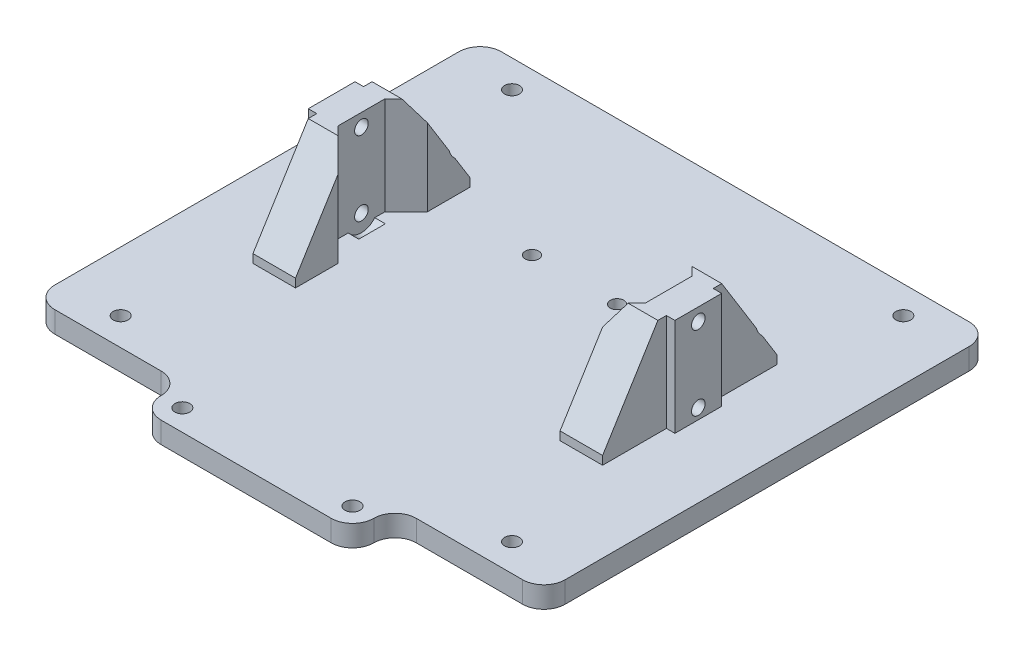
from build123d import *

# Parameters (mm, degrees)
EXTRUDE_1_DEPTH         = 5
FILLET_1_R              = 5
SKETCH_2_W              = 7
SKETCH_2_H              = 11
EXTRUDE_2_DEPTH         = 23
SKETCH_3_R              = 1.6
CUT_EXTRUDE_1_DEPTH     = 119.006186279
SKETCH_5_R              = 1.75
CUT_EXTRUDE_3_DEPTH     = 90.639556001
SKETCH_6_R              = 1.75
CUT_EXTRUDE_4_DEPTH     = 90.639556001
SKETCH2_R               = 4
CUT_EXTRUDE1_DEPTH      = 2.5
CUT_EXTRUDE2_START      = 2.5
SKETCH3_R               = 4
CUT_EXTRUDE2_DEPTH      = 2.5
CUT_EXTRUDE3_DEPTH      = 90.639556001
CUT_EXTRUDE3_DEPTH_BACK = 90.639556001
SKETCH4_R               = 1.6
EXTRUDE_4_DEPTH         = 5
EXTRUDE_4_DEPTH_BACK    = 5
EXTRUDE_5_DEPTH         = 5
EXTRUDE_5_DEPTH_BACK    = 5
CHAMFER_1_SIZE          = 5
SKETCH_12_R             = 1.6
EXTRUDE_6_DEPTH         = 5


with BuildPart() as part:
    # 스케치1 → 보스-돌출1 (new body)
    with BuildSketch(Plane(origin=(0, 0, 0), x_dir=(1, 0, 0), z_dir=(0, 1, 0))):
        Polygon((-25, -52.5), (-60, -52.5), (-60, 52.5), (60, 52.5), (60, -52.5), (25, -52.5), (25, -62.5), (-25, -62.5), align=None)
    extrude(amount=EXTRUDE_1_DEPTH)

    # 필렛1
    fillet_1_edges = [part.edges().sort_by_distance(p)[0] for p in [
        (60, 2.5, -52.5),
        (60, 2.5, 52.5),
        (-60, 2.5, -52.5),
        (-60, 2.5, 52.5),
        (-25, 2.5, 52.5),
        (25, 2.5, 52.5),
        (25, 2.5, 62.5),
        (-25, 2.5, 62.5),
    ]]
    fillet(fillet_1_edges, radius=FILLET_1_R - 0.0001)  # a hair under: the kernel refuses the full size

    # 스케치5 → 컷-돌출3 (cut, through all)
    with BuildSketch(Plane(origin=(0, 5, 0), x_dir=(1, 0, 0), z_dir=(0, 1, 0))):
        with Locations(Location((-46, -46, 0), (0, 0, 270))):
            Circle(SKETCH_5_R)
        with Locations(Location((-46, 46, 0), (0, 0, 270))):
            Circle(SKETCH_5_R)
        with Locations(Location((46, 46, 0), (0, 0, 270))):
            Circle(SKETCH_5_R)
        with Locations(Location((46, -46, 0), (0, 0, 270))):
            Circle(SKETCH_5_R)
    extrude(amount=-CUT_EXTRUDE_3_DEPTH, mode=Mode.SUBTRACT)

    # 스케치6 → 컷-돌출4 (cut, through all)
    with BuildSketch(Plane(origin=(0, 5, 0), x_dir=(1, 0, 0), z_dir=(0, 1, 0))):
        with Locations(Location((20, -57.5, 0), (0, 0, 270))):
            Circle(SKETCH_6_R)
        with Locations(Location((-20, -57.5, 0), (0, 0, 270))):
            Circle(SKETCH_6_R)
    extrude(amount=-CUT_EXTRUDE_4_DEPTH, mode=Mode.SUBTRACT)

    # Sketch2 → Cut-Extrude1 (cut)
    with BuildSketch(Plane.ZY.offset(-36.1)):
        with Locations((-0.7, 7.5)):
            Circle(SKETCH2_R)
    extrude(amount=CUT_EXTRUDE1_DEPTH, mode=Mode.SUBTRACT)

    # Sketch3 → Cut-Extrude2 (cut)
    with BuildSketch(Plane(origin=(-36.1, 0, 0), x_dir=(0, 0, -1), z_dir=(1, 0, 0)).offset(CUT_EXTRUDE2_START)):
        with Locations((0.7, 7.5)):
            Circle(SKETCH3_R)
    extrude(amount=-CUT_EXTRUDE2_DEPTH, mode=Mode.SUBTRACT)

    # Sketch4 → Cut-Extrude3 (cut, two sides: drawn at the far end of the back side and taken through both)
    with BuildSketch(Plane(origin=(0, 5, 0), x_dir=(1, 0, 0), z_dir=(0, 1, 0)).offset(-CUT_EXTRUDE3_DEPTH_BACK)):
        with Locations(Location((-10, 0, 0), (0, 0, 270))):
            Circle(SKETCH4_R)
        with Locations(Location((10, 0, 0), (0, 0, 270))):
            Circle(SKETCH4_R)
        with Locations(Location((-10, 14.7, 0), (0, 0, 270))):
            Circle(SKETCH4_R)
        with Locations(Location((10, 14.7, 0), (0, 0, 270))):
            Circle(SKETCH4_R)
    extrude(amount=CUT_EXTRUDE3_DEPTH + CUT_EXTRUDE3_DEPTH_BACK, mode=Mode.SUBTRACT)



with BuildPart() as body_2:
    # 스케치2 → 보스-돌출2 (new body)
    with BuildSketch(Plane(origin=(0, 5, 0), x_dir=(1, 0, 0), z_dir=(0, 1, 0))):
        with Locations((-39.6, 0.7)):
            Rectangle(SKETCH_2_W, SKETCH_2_H)
    extrude(amount=EXTRUDE_2_DEPTH)

    # 스케치3 → 컷-돌출1 (cut, through all)
    with BuildSketch(Plane(origin=(-36.1, 0, 0), x_dir=(0, 0, -1), z_dir=(1, 0, 0))):
        with Locations((0.7, 25)):
            Circle(SKETCH_3_R)
        with Locations((0.7, 7.5)):
            Circle(SKETCH_3_R)
    extrude(amount=-CUT_EXTRUDE_1_DEPTH, mode=Mode.SUBTRACT)


with BuildPart() as body_3:
    # 대칭 복사1: mirrored copy
    add(body_2.part.mirror(Plane(origin=(0, 0, 0), x_dir=(0, 0, 1), z_dir=(1, 0, 0))))


with BuildPart() as part_1:
    add(part.part)

    add(body_2.part)  # 보스-돌출4 merges body 2
    # 스케치9 → 보스-돌출4 (add, two sides: drawn at the far end of the back side and taken through both)
    with BuildSketch(Plane(origin=(-36.1, 0, 0), x_dir=(0, 0, -1), z_dir=(1, 0, 0)).offset(-EXTRUDE_4_DEPTH_BACK)):
        Polygon((-19.8, 5), (-4.8, 5), (-4.8, 28), (-6.8, 28), (-19.8, 7), align=None)
        with BuildLine():
            Line((16.356233456, 14.824545956), (8.2, 28))
            Line((8.2, 28), (6.2, 28))
            Line((6.2, 28), (6.2, 5))
            Line((6.2, 5), (21.2, 5))
            Line((21.2, 5), (21.2, 7))
            Line((21.2, 7), (17.710979659, 12.636109782))
            ThreePointArc((17.710979659, 12.636109782), (16.87380684, 13.631404234), (16.356233456, 14.824545956))
        make_face()
    extrude(amount=EXTRUDE_4_DEPTH + EXTRUDE_4_DEPTH_BACK)


    add(body_3.part)  # 보스-돌출5 merges body 3
    # 스케치10 → 보스-돌출5 (add, two sides: drawn at the far end of the back side and taken through both)
    with BuildSketch(Plane.ZY.offset(-36.1).offset(-EXTRUDE_5_DEPTH_BACK)):
        with BuildLine():
            Line((-21.2, 5), (-6.2, 5))
            Line((-6.2, 5), (-6.2, 28))
            Line((-6.2, 28), (-8.2, 28))
            Line((-8.2, 28), (-16.356233456, 14.824545956))
            ThreePointArc((-16.356233456, 14.824545956), (-16.87380684, 13.631404234), (-17.710979659, 12.636109782))
            Line((-17.710979659, 12.636109782), (-21.2, 7))
            Line((-21.2, 7), (-21.2, 5))
        make_face()
        Polygon((6.8, 28), (4.8, 28), (4.8, 5), (19.8, 5), (19.8, 7), align=None)
    extrude(amount=EXTRUDE_5_DEPTH + EXTRUDE_5_DEPTH_BACK)

    # 모따기1
    chamfer_1_edges = [part_1.edges().sort_by_distance(p)[0] for p in [
        (31.1, 16.5, 4.8),
        (31.1, 16.5, -6.2),
        (-31.1, 16.5, 4.8),
        (-31.1, 16.5, -6.2),
    ]]
    chamfer(chamfer_1_edges, length=CHAMFER_1_SIZE - 0.0001)  # a hair under: the kernel refuses the full size

    # 스케치12 → 보스-돌출6 (add)
    with BuildSketch(Plane(origin=(0, 5, 0), x_dir=(1, 0, 0), z_dir=(0, 1, 0))):
        with Locations((-10, 0)):
            Circle(SKETCH_12_R)
        with Locations((10, 0)):
            Circle(SKETCH_12_R)
    extrude(amount=-EXTRUDE_6_DEPTH)


solid = part_1.part
